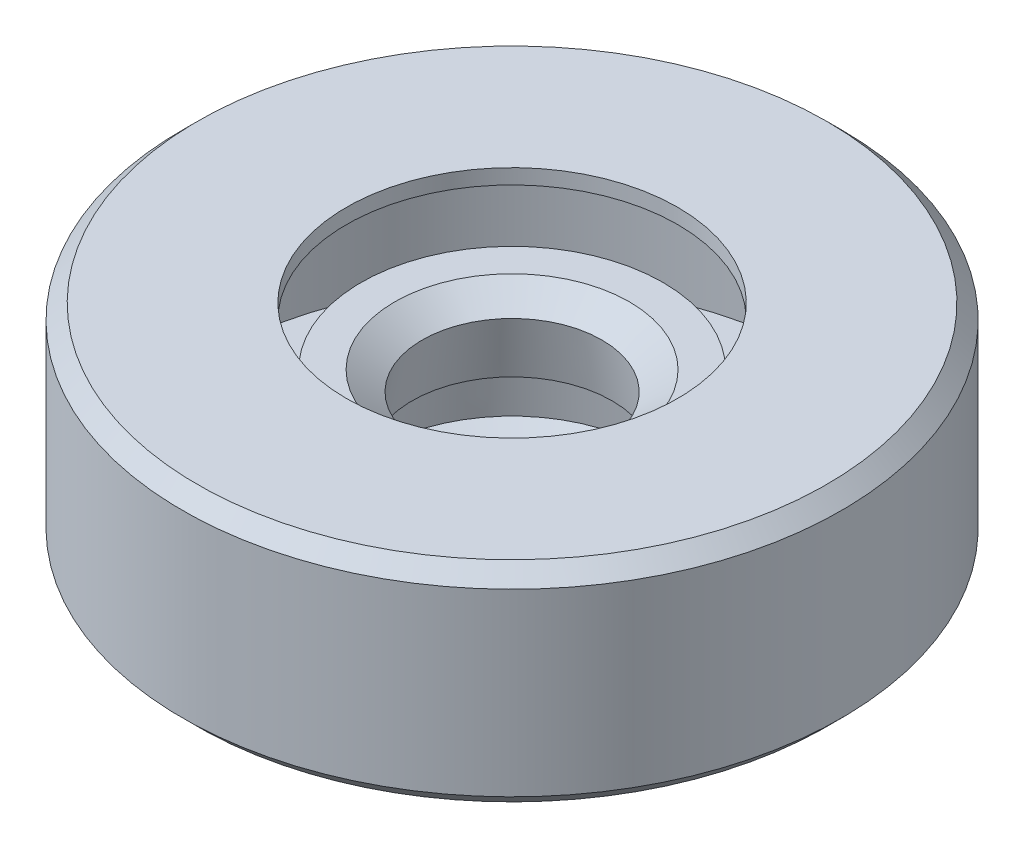
from build123d import *


with BuildPart() as part:
    # 草图1 → 旋转1 (revolve)
    with BuildSketch(Plane.XY):
        with BuildLine():
            Line((-4.838882373, 3.10342775), (-5.028769085, 0.933012702))
            Line((-5.028769085, 0.933012702), (-5.528769085, 0.933012702))
            Line((-5.528769085, 0.933012702), (-5.778769085, 0.5))
            Line((-5.778769085, 0.5), (-10, 0.5))
            Line((-10, 0.5), (-10, 6.5))
            Line((-10, 6.5), (-5.528769085, 6.5))
            Line((-5.528769085, 6.5), (-5.528769085, 7))
            Line((-5.528769085, 7), (-10.5, 7))
            Line((-10.5, 7), (-11, 6.5))
            Line((-11, 6.5), (-11, 0.5))
            Line((-11, 0.5), (-10.5, 0))
            Line((-10.5, 0), (-5.0084872, 0))
            ThreePointArc((-5.0084872, 0), (-4.6084872, 0.3), (-4.2084872, 0))
            Line((-4.2084872, 0), (-3.340059177, 0.075977607))
            Line((-3.340059177, 0.075977607), (-4.564742869, 0.5))
            Line((-4.564742869, 0.5), (-4.389765542, 2.5))
            Line((-4.389765542, 2.5), (-3.340059177, 2.5))
            Line((-3.340059177, 2.5), (-3, 4.428571429))
            Line((-3, 4.428571429), (-3.918095147, 5.071428571))
            Line((-3.918095147, 5.071428571), (-5.038882373, 5.071428571))
            Line((-5.038882373, 5.071428571), (-5.038882373, 3.950641346))
            ThreePointArc((-5.038882373, 3.950641346), (-5.274132553, 3.447892716), (-4.838882373, 3.10342775))
        make_face()
    revolve(axis=Axis((0, 0, 0), (0, 1, 0)))


solid = part.part
